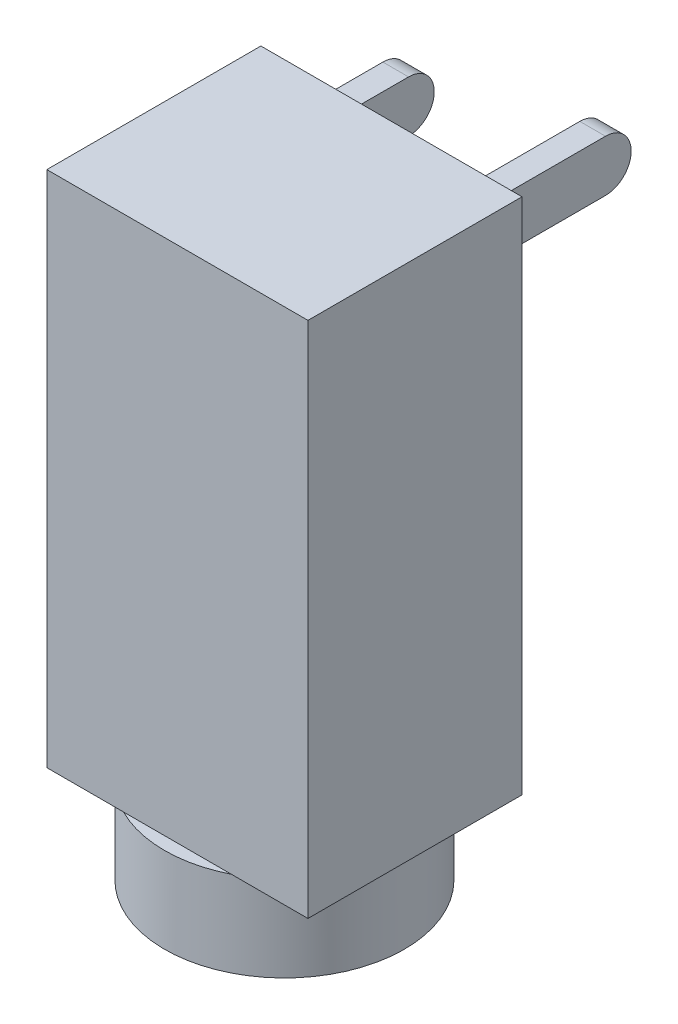
from build123d import *

# Parameters (mm, degrees)
SKETCH1_W           = 6.1
SKETCH1_H           = 12.1
BOSS_EXTRUDE1_DEPTH = 5
SKETCH2_R           = 2.8
SKETCH2_R_2         = 1.8
BOSS_EXTRUDE2_DEPTH = 2
SKETCH3_R           = 0.75
BOSS_EXTRUDE3_DEPTH = 1
SKETCH4_W           = 0.6
SKETCH4_H           = 1.2
BOSS_EXTRUDE4_DEPTH = 3
FILLET1_R           = 0.6


with BuildPart() as part:
    # Sketch1 → Boss-Extrude1 (new body)
    with BuildSketch(Plane.XY):
        Rectangle(SKETCH1_W, SKETCH1_H)
    extrude(amount=BOSS_EXTRUDE1_DEPTH)

    # Sketch2 → Boss-Extrude2 (add)
    with BuildSketch(Plane.XZ.offset(6.05)):
        with Locations(Location((0, 2.5, 0), (0, 0, 63.234499423))):
            Circle(SKETCH2_R)
        with Locations(Location((0, 2.5, 0), (0, 0, 270))):
            Circle(SKETCH2_R_2, mode=Mode.SUBTRACT)
    extrude(amount=BOSS_EXTRUDE2_DEPTH)

    # Sketch3 → Boss-Extrude3 (add)
    with BuildSketch(Plane(origin=(0, 0, 0), x_dir=(-1, 0, 0), z_dir=(0, 0, -1))):
        with Locations(Location((0, -4.45, 0), (0, 0, 180))):
            Circle(SKETCH3_R)
        with Locations(Location((0, 2.55, 0), (0, 0, 180))):
            Circle(SKETCH3_R)
    extrude(amount=BOSS_EXTRUDE3_DEPTH)

    # Sketch4 → Boss-Extrude4 (add)
    with BuildSketch(Plane(origin=(0, 0, 0), x_dir=(-1, 0, 0), z_dir=(0, 0, -1))):
        with Locations((2.3, -2.85)):
            Rectangle(SKETCH4_W, SKETCH4_H)
        with Locations((2.3, 0.15)):
            Rectangle(SKETCH4_W, SKETCH4_H)
        with Locations((2.3, 4.15)):
            Rectangle(SKETCH4_W, SKETCH4_H)
        with Locations((-2.3, 5.25)):
            Rectangle(SKETCH4_W, SKETCH4_H)
    extrude(amount=BOSS_EXTRUDE4_DEPTH)

    # Fillet1
    fillet1_edges = [part.edges().sort_by_distance(p)[0] for p in [
        (-2.3, 4.75, -3),
        (2.3, 5.85, -3),
        (2.3, 4.65, -3),
        (-2.3, 3.55, -3),
        (-2.3, 0.75, -3),
        (-2.3, -0.45, -3),
        (-2.3, -2.25, -3),
        (-2.3, -3.45, -3),
    ]]
    fillet(fillet1_edges, radius=FILLET1_R - 0.0001)  # a hair under: the kernel refuses the full size


solid = part.part
